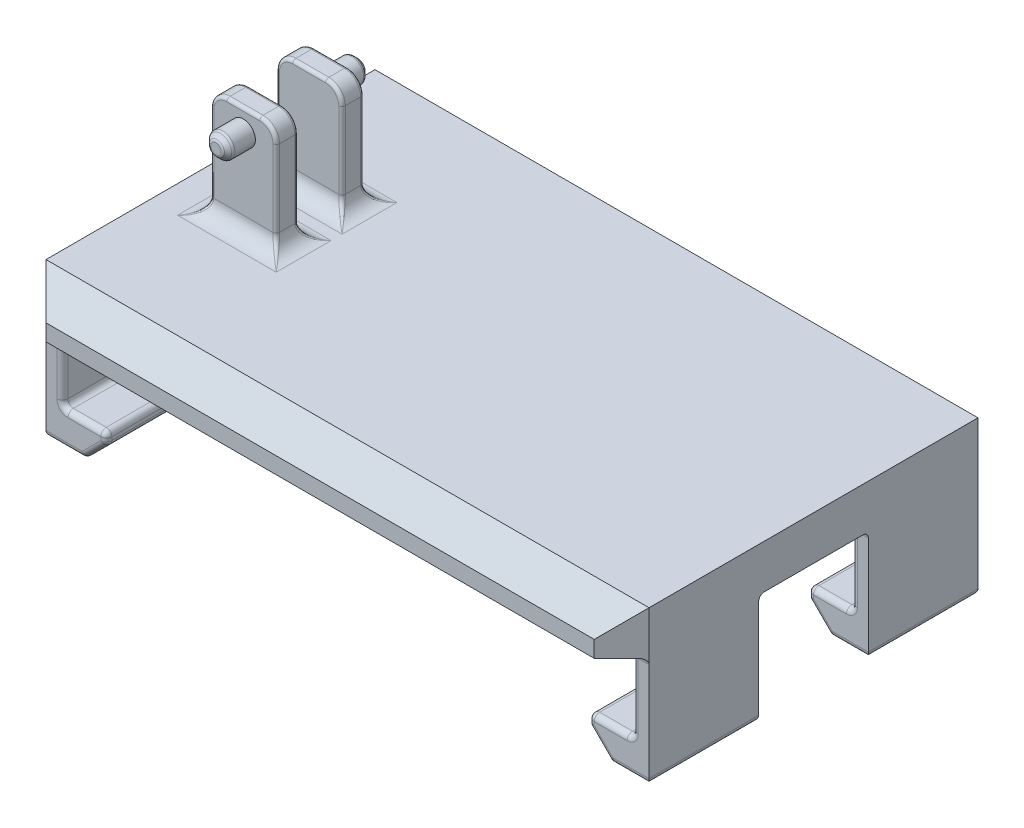
from build123d import *

# Parameters (mm, degrees)
SKETCH1_W                = 27.5
SKETCH1_H                = 17.5
BOSS_EXTRUDE1_DEPTH      = 2
SKETCH4_W                = 0.75
SKETCH4_H                = 5
BOSS_EXTRUDE4_DEPTH      = 5
SKETCH3_W                = 5
SKETCH3_H                = 1.5
BOSS_EXTRUDE3_DEPTH      = 2
CHAMFER1_SIZE            = 1
FILLET3_R                = 0.25
CHAMFER1_OF_MIRROR2_SIZE = 1
FILLET3_OF_MIRROR2_R     = 0.25
CHAMFER2_SIZE            = 1.25
SKETCH5_W                = 3
SKETCH5_H                = 1
BOSS_EXTRUDE5_DEPTH      = 5
SKETCH6_R                = 0.55
BOSS_EXTRUDE6_DEPTH      = 1.25
CHAMFER3_SIZE            = 0.25
FILLET4_R                = 0.75
FILLET5_R                = 0.15


# Read off the part's stored shape, not the designer's step: Mirror3
with BuildPart() as part:
    # Sketch1 → Boss-Extrude1 (new body)
    with BuildSketch(Plane(origin=(0, 0, 0), x_dir=(1, 0, 0), z_dir=(0, 1, 0))):
        Rectangle(SKETCH1_W, SKETCH1_H)
    extrude(amount=BOSS_EXTRUDE1_DEPTH)

    # Sketch4 → Boss-Extrude4 (add)
    with BuildSketch(Plane.XZ):
        with Locations((13.375, -5)):
            Rectangle(SKETCH4_W, SKETCH4_H)
    boss_extrude4 = extrude(amount=BOSS_EXTRUDE4_DEPTH)

    # Sketch3 → Boss-Extrude3 (add)
    with BuildSketch(Plane.ZY.offset(-13)):
        with Locations((-5, -4.25)):
            Rectangle(SKETCH3_W, SKETCH3_H)
    boss_extrude3 = extrude(amount=BOSS_EXTRUDE3_DEPTH)

    # Chamfer1
    chamfer1_edges = [part.edges().sort_by_distance(p)[0] for p in [
        (11, -5, -5),
    ]]
    chamfer(chamfer1_edges, length=CHAMFER1_SIZE)

    # Fillet3
    fillet3_edges = [part.edges().sort_by_distance(p)[0] for p in [
        (13.375, 0, -2.5),
        (13, 0, -5),
        (13, -1.75, -2.5),
        (13, -1.75, -7.5),
        (13.375, 0, -7.5),
        (13.75, -5, -5),
        (12.875, -5, -7.5),
        (12.875, -5, -2.5),
        (13, -3.5, -5),
        (12, -3.5, -2.5),
        (12, -3.5, -7.5),
        (12, -5, -5),
        (11.5, -4.5, -7.5),
        (11.5, -4.5, -2.5),
        (11, -3.75, -2.5),
        (11, -4, -5),
        (11, -3.5, -5),
        (11, -3.75, -7.5),
    ]]
    fillet(fillet3_edges, radius=FILLET3_R)

    # Mirror2: Boss-Extrude4, Boss-Extrude3 across plane
    add(boss_extrude4.mirror(Plane(origin=(0, 0, 0), x_dir=(0, 0, 1), z_dir=(1, 0, 0))))
    add(boss_extrude3.mirror(Plane(origin=(0, 0, 0), x_dir=(0, 0, 1), z_dir=(1, 0, 0))))

    # Chamfer1 of Mirror2
    chamfer1_of_mirror2_edges = [part.edges().sort_by_distance(p)[0] for p in [
        (-11, -5, -5),
    ]]
    chamfer(chamfer1_of_mirror2_edges, length=CHAMFER1_OF_MIRROR2_SIZE)

    # Fillet3 of Mirror2
    fillet3_of_mirror2_edges = [part.edges().sort_by_distance(p)[0] for p in [
        (-13.375, 0, -2.5),
        (-13, 0, -5),
        (-13, -1.75, -2.5),
        (-13, -1.75, -7.5),
        (-13.375, 0, -7.5),
        (-13.75, -5, -5),
        (-12.875, -5, -7.5),
        (-12.875, -5, -2.5),
        (-13, -3.5, -5),
        (-12, -3.5, -2.5),
        (-12, -3.5, -7.5),
        (-12, -5, -5),
        (-11.5, -4.5, -7.5),
        (-11.5, -4.5, -2.5),
        (-11, -3.75, -2.5),
        (-11, -4, -5),
        (-11, -3.5, -5),
        (-11, -3.75, -7.5),
    ]]
    fillet(fillet3_of_mirror2_edges, radius=FILLET3_OF_MIRROR2_R)

    # Mirror3: part across plane


with BuildPart() as part_1:
    add(part.part)
    add(part.part.mirror(Plane.XY))

    # Chamfer2
    chamfer2_edges = [part_1.edges().sort_by_distance(p)[0] for p in [
        (13.75, 1, -8.75),
        (13.75, 1, 8.75),
        (-13.75, 1, 8.75),
        (-13.75, 1, -8.75),
        (0, 2, 8.75),
        (0, 2, -8.75),
    ]]
    chamfer(chamfer2_edges, length=CHAMFER2_SIZE - 0.0001)  # a hair under: the kernel refuses the full size

    # Sketch5 → Boss-Extrude5 (add)
    with BuildSketch(Plane(origin=(0, 2, 0), x_dir=(1, 0, 0), z_dir=(0, 1, 0))):
        with Locations((-10.25, 1.5)):
            Rectangle(SKETCH5_W, SKETCH5_H)
    boss_extrude5 = extrude(amount=BOSS_EXTRUDE5_DEPTH)

    # Sketch6 → Boss-Extrude6 (add)
    with BuildSketch(Plane(origin=(0, 0, -2), x_dir=(-1, 0, 0), z_dir=(0, 0, -1))):
        with Locations(Location((10.25, 6, 0), (0, 0, 180))):
            Circle(SKETCH6_R)
    boss_extrude6 = extrude(amount=BOSS_EXTRUDE6_DEPTH)

    # Mirror11: Boss-Extrude5, Boss-Extrude6 across plane
    add(boss_extrude5.mirror(Plane.XY))
    add(boss_extrude6.mirror(Plane.XY))

    # Chamfer3
    chamfer3_edges = [part_1.edges().sort_by_distance(p)[0] for p in [
        (-10.8, 6, -3.25),
        (-10.8, 6, 3.25),
    ]]
    chamfer(chamfer3_edges, length=CHAMFER3_SIZE)

    # Fillet4
    fillet4_edges = [part_1.edges().sort_by_distance(p)[0] for p in [
        (-8.75, 2, -1.5),
        (-10.25, 2, -2),
        (-11.75, 2, -1.5),
        (-10.25, 2, -1),
        (-8.75, 7, -1.5),
        (-11.75, 7, -1.5),
        (-8.75, 7, 1.5),
        (-11.75, 7, 1.5),
        (-8.75, 2, 1.5),
        (-10.25, 2, 2),
        (-11.75, 2, 1.5),
        (-10.25, 2, 1),
    ]]
    fillet(fillet4_edges, radius=FILLET4_R)

    # Fillet5
    fillet5_edges = [part_1.edges().sort_by_distance(p)[0] for p in [
        (-10.8, 6, -2),
        (-10.8, 6, 3),
        (-10.55, 6, 3.25),
        (-10.55, 6, -3.25),
        (-10.8, 6, -3),
        (-11.75, 4.5, 1),
        (-10.25, 7, 1),
        (-8.75, 4.5, 1),
        (-11.530330086, 6.780330086, 1),
        (-8.969669914, 6.780330086, 1),
        (-11.75, 4.5, 2),
        (-8.75, 4.5, 2),
        (-10.25, 7, 2),
        (-11.530330086, 6.780330086, 2),
        (-8.969669914, 6.780330086, 2),
        (-10.25, 7, -2),
        (-10.25, 7, -1),
        (-8.75, 4.5, -1),
        (-11.75, 4.5, -1),
        (-8.969669914, 6.780330086, -1),
        (-11.530330086, 6.780330086, -1),
        (-11.75, 4.5, -2),
        (-8.75, 4.5, -2),
        (-8.969669914, 6.780330086, -2),
        (-11.530330086, 6.780330086, -2),
        (-12.015463319, 2.177527987, 2.265463319),
        (-8.484536681, 2.177527987, 2.265463319),
        (-12.015463319, 2.177527987, 0.734536681),
        (-8.484536681, 2.177527987, 0.734536681),
        (-12.015463319, 2.177527987, -0.734536681),
        (-12.015463319, 2.177527987, -2.265463319),
        (-8.484536681, 2.177527987, -0.734536681),
        (-8.484536681, 2.177527987, -2.265463319),
    ]]
    fillet(fillet5_edges, radius=FILLET5_R)


solid = part_1.part
